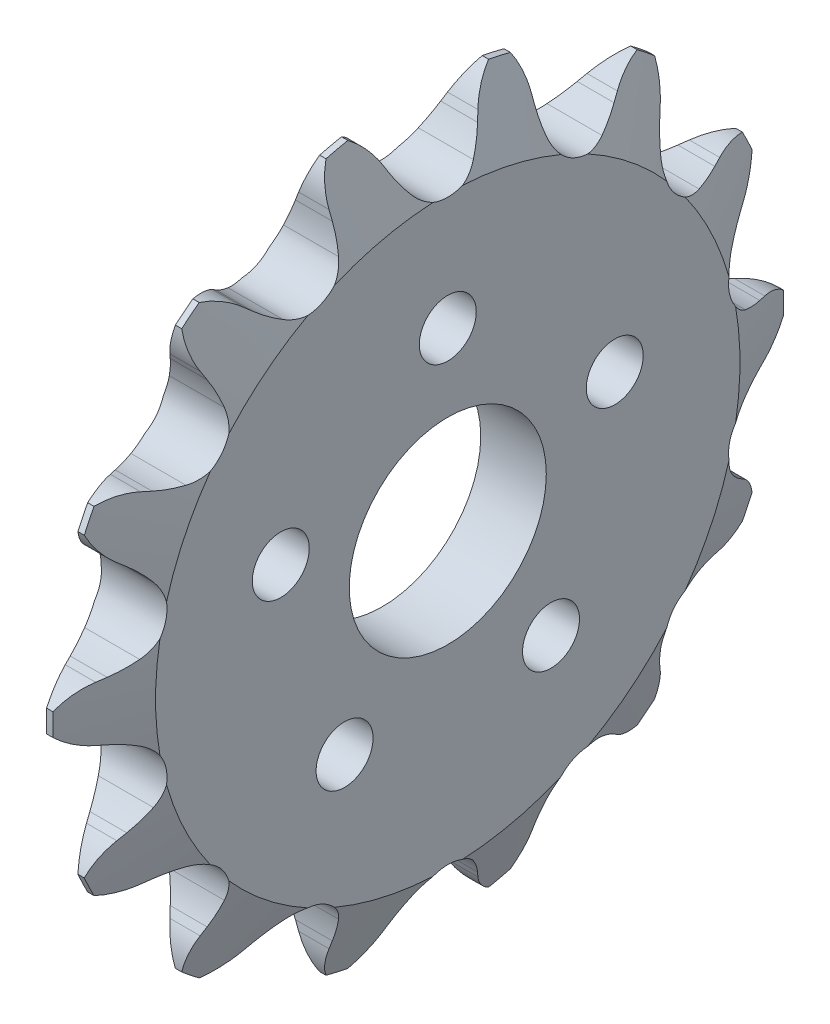
from build123d import *

# Parameters (mm, degrees)
CUT_EXTRUDE1_DEPTH = 34.702877376
CIRPATTERN1_COUNT  = 14
SKETCH4_R          = 6.4135
SKETCH4_R_2        = 1.8542
CUT_EXTRUDE2_DEPTH = 34.594206928


with BuildPart() as part:
    # Sketch2 → Revolve1 (revolve)
    with BuildSketch(Plane.XY):
        Polygon((-0.206375, 23.783730725), (0.206375, 23.783730725), (2.1336, 19.021230725), (2.1336, 0), (-2.1336, 0), (-2.1336, 19.021230725), align=None)
    revolve(axis=Axis((-2.1336, 0, 0), (1, 0, 0)))

    # Sketch3 → Cut-Extrude1 (cut, symmetric)
    with BuildSketch(Plane(origin=(0, 0, 0), x_dir=(0, 0, -1), z_dir=(1, 0, 0))):
        with BuildLine():
            Line((-3.105520163, 21.62831054), (-2.87166915, 21.133275475))
            ThreePointArc((-2.87166915, 21.133275475), (-2.48040659, 20.421150993), (-2.005274299, 19.76201749))
            ThreePointArc((-2.005274299, 19.76201749), (0, 18.811680725), (2.005274299, 19.76201749))
            ThreePointArc((2.005274299, 19.76201749), (2.48040659, 20.421150993), (2.87166915, 21.133275475))
            Line((2.87166915, 21.133275475), (3.105520163, 21.62831054))
            ThreePointArc((3.105520163, 21.62831054), (4.058048937, 22.927301986), (5.426829822, 23.776494973))
            ThreePointArc((5.426829822, 23.776494973), (0, 24.387951844), (-5.426829822, 23.776494973))
            ThreePointArc((-5.426829822, 23.776494973), (-4.058048937, 22.927301986), (-3.105520163, 21.62831054))
        make_face()
    cut_extrude1 = extrude(amount=CUT_EXTRUDE1_DEPTH, both=True, mode=Mode.SUBTRACT)

    # CirPattern1: Cut-Extrude1 ×14 about axis
    cirpattern1_axis = Axis((-88.99, 0, 0), (1, 0, 0))
    for i in range(1, CIRPATTERN1_COUNT):
        add(cut_extrude1.rotate(cirpattern1_axis, i * 360 / CIRPATTERN1_COUNT), mode=Mode.SUBTRACT)

    # Sketch4 → Cut-Extrude2 (cut, through all)
    with BuildSketch(Plane(origin=(2.1336, 0, 0), x_dir=(0, 0, -1), z_dir=(1, 0, 0))):
        Circle(SKETCH4_R)
        with Locations((0, 11.43)):
            Circle(SKETCH4_R_2)
        with Locations((10.870575981, 3.532064246)):
            Circle(SKETCH4_R_2)
        with Locations((6.718385434, -9.247064246)):
            Circle(SKETCH4_R_2)
        with Locations((-6.718385434, -9.247064246)):
            Circle(SKETCH4_R_2)
        with Locations((-10.870575981, 3.532064246)):
            Circle(SKETCH4_R_2)
    extrude(amount=-CUT_EXTRUDE2_DEPTH, mode=Mode.SUBTRACT)


solid = part.part
